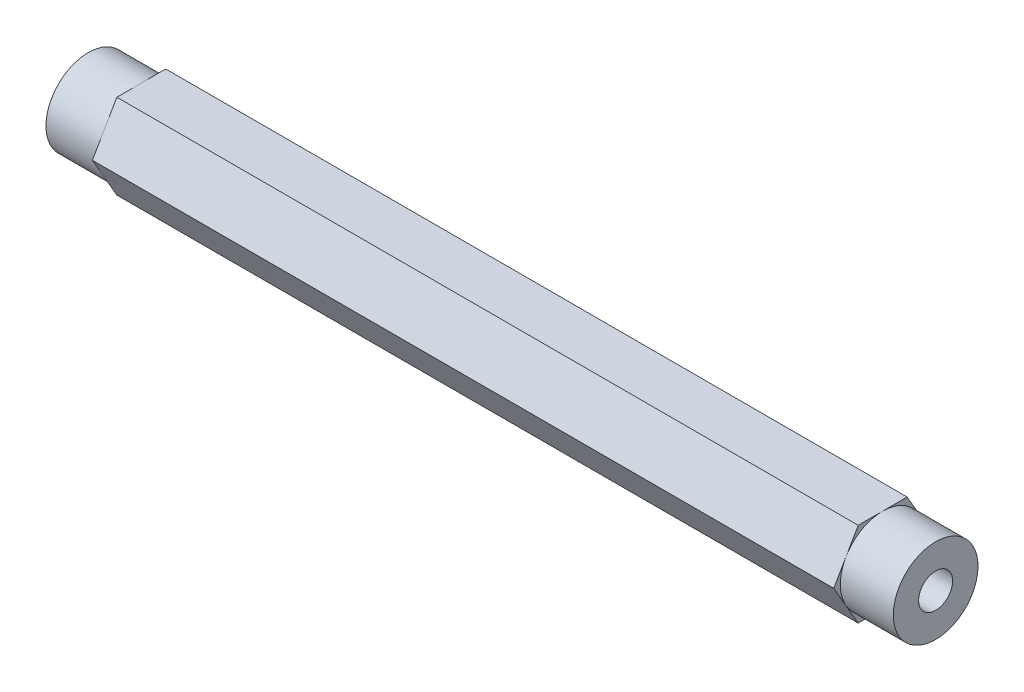
from build123d import *

# Parameters (mm, degrees)
BOSS_EXTRUDE1_DEPTH                   = 63.5
SKETCH3_R                             = 8.89
SKETCH3_R_2                           = 6.35
CUT_EXTRUDE_THIN1_DEPTH               = 7.9375
F_1_4_20_TAPPED_HOLE1_D               = 5.1054
F_1_4_20_TAPPED_HOLE1_DEPTH           = 16.51
F_1_4_20_TAPPED_HOLE1_TIP             = 1.533816902
F_1_4_20_TAPPED_HOLE1_ON_FACE_2_D     = 5.1054
F_1_4_20_TAPPED_HOLE1_ON_FACE_2_DEPTH = 16.51
F_1_4_20_TAPPED_HOLE1_ON_FACE_2_TIP   = 1.533816902


with BuildPart() as part:
    # Sketch2 → Boss-Extrude1 (new, symmetric)
    with BuildSketch(Plane(origin=(0, 0, 0), x_dir=(0, 0, -1), z_dir=(1, 0, 0))):
        Polygon((7.332348419, 0), (3.666174209, 6.35), (-3.666174209, 6.35), (-7.332348419, 0), (-3.666174209, -6.35), (3.666174209, -6.35), align=None)
    extrude(amount=BOSS_EXTRUDE1_DEPTH, both=True)

    # Sketch3 → Cut-Extrude-Thin1 (cut)
    with BuildSketch(Plane(origin=(63.5, 0, 0), x_dir=(0, 0, -1), z_dir=(1, 0, 0))):
        Circle(SKETCH3_R)
        Circle(SKETCH3_R_2, mode=Mode.SUBTRACT)
    cut_extrude_thin1 = extrude(amount=-CUT_EXTRUDE_THIN1_DEPTH, mode=Mode.SUBTRACT)

    # Mirror1: Cut-Extrude-Thin1 across plane
    add(cut_extrude_thin1.mirror(Plane(origin=(0, 0, 0), x_dir=(0, 0, 1), z_dir=(1, 0, 0))), mode=Mode.SUBTRACT)

    # 1/4-20 Tapped Hole1
    with Locations(Plane(origin=(63.5, 0, 0), x_dir=(0, 0, 1), z_dir=(1, 0, 0))):
        with Locations((0, 0)):
            Hole(F_1_4_20_TAPPED_HOLE1_D / 2, depth=F_1_4_20_TAPPED_HOLE1_DEPTH)
            with Locations((0, 0, -(F_1_4_20_TAPPED_HOLE1_DEPTH + F_1_4_20_TAPPED_HOLE1_TIP / 2))):  # 118° drill point
                Cone(0, F_1_4_20_TAPPED_HOLE1_D / 2, F_1_4_20_TAPPED_HOLE1_TIP, mode=Mode.SUBTRACT)

    # 1/4-20 Tapped Hole1 on face 2
    with Locations(Plane(origin=(-63.5, 0, 0), x_dir=(0, 0, -1), z_dir=(-1, 0, 0))):
        with Locations((0, 0)):
            Hole(F_1_4_20_TAPPED_HOLE1_ON_FACE_2_D / 2, depth=F_1_4_20_TAPPED_HOLE1_ON_FACE_2_DEPTH)
            with Locations((0, 0, -(F_1_4_20_TAPPED_HOLE1_ON_FACE_2_DEPTH + F_1_4_20_TAPPED_HOLE1_ON_FACE_2_TIP / 2))):  # 118° drill point
                Cone(0, F_1_4_20_TAPPED_HOLE1_ON_FACE_2_D / 2, F_1_4_20_TAPPED_HOLE1_ON_FACE_2_TIP, mode=Mode.SUBTRACT)


solid = part.part
